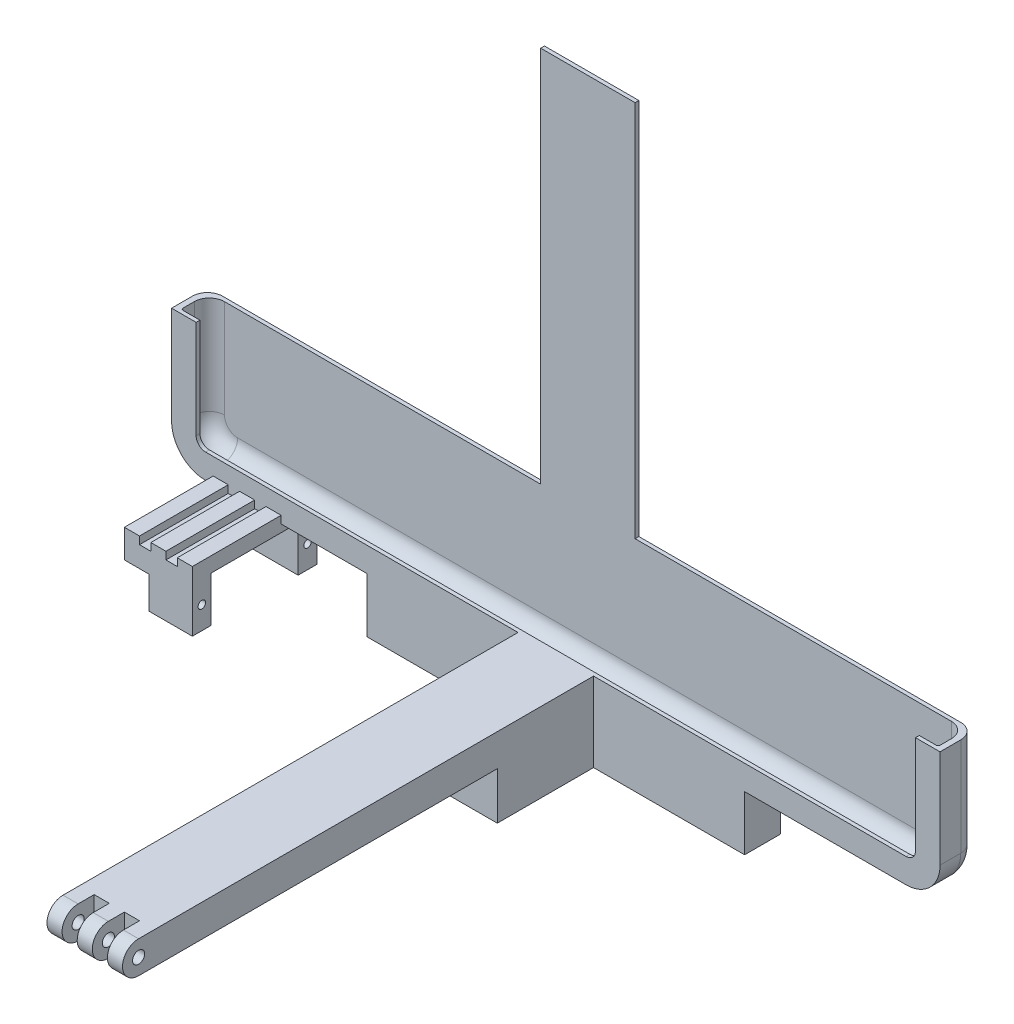
from build123d import *

# Parameters (mm, degrees)
ESQUISSE1_W                    = 203.5
ESQUISSE1_H                    = 35
BOSS_EXTRU_1_DEPTH             = 1
CONG_1_R                       = 9
BOSS_EXTRU_2_START             = 8.5
BOSS_EXTRU_2_DEPTH             = 8.5
BOSS_EXTRU_3_DEPTH             = 1
CONG_2_R                       = 4
CONG_3_R                       = 0.5
BOSS_EXTRU_4_START             = 91.75
BOSS_EXTRU_4_DEPTH             = 20
ESQUISSE8_W                    = 20
ESQUISSE8_H                    = 120.5
BOSS_EXTRU_5_DEPTH             = 6.5
ESQUISSE9_R                    = 4.25
BOSS_EXTRU_6_DEPTH             = 20
BOSS_EXTRU_10_START            = 51.75
BOSS_EXTRU_10_DEPTH            = 100
BOSS_EXTRU_10_START_2          = 91.75
BOSS_EXTRU_10_2_OUTLINE_W      = 12.5
BOSS_EXTRU_10_2_OUTLINE_H      = 25.5
BOSS_EXTRU_10_2_DEPTH          = 20
ESQUISSE21_W                   = 25
ESQUISSE21_H                   = 1
BOSS_EXTRU_11_DEPTH            = 100
ENL_V_MAT_EXTRU_2_DEPTH        = 4
R_P_TITION_LIN_AIRE2_COUNT     = 2
R_P_TITION_LIN_AIRE2_PITCH     = 8
ENL_V_START                    = -20
ESQUISSE12_R                   = 1.6
ENL_V_MAT_EXTRU_4_DEPTH        = 20
BOSS_EXTRU_7_START             = 11
BOSS_EXTRU_7_DEPTH             = 18
ESQUISSE15_W                   = 18
ESQUISSE15_H                   = 5
BOSS_EXTRU_8_DEPTH             = 12
ENL_V_MAT_EXTRU_5_REACH        = 260.26
ESQUISSE16_R                   = 1
ESQUISSE17_W                   = 4
ESQUISSE17_H                   = 23.5
BOSS_EXTRU_9_DEPTH             = 2
R_P_TITION_LIN_AIRE1_COUNT     = 2
R_P_TITION_LIN_AIRE1_PITCH     = 7
R_P_TITION_LIN_AIRE1_COL_COUNT = 2
R_P_TITION_LIN_AIRE1_COL_PITCH = 7
ENL_V_MAT_EXTRU_6_REACH        = 266.365
ESQUISSE18_W                   = 6.5
ESQUISSE18_H                   = 8.5


# Read off the part's stored shape, not the designer's step: Boss.-Extru.4, Boss.-Extru.10, Boss.-Extru.7
with BuildPart() as part:
    # Esquisse1 → Boss.-Extru.1 (new body)
    with BuildSketch(Plane.XY):
        with Locations((101.75, 17.5)):
            Rectangle(ESQUISSE1_W, ESQUISSE1_H)
    extrude(amount=BOSS_EXTRU_1_DEPTH)

    # Congé1
    cong_1_edges = [part.edges().sort_by_distance(p)[0] for p in [
        (203.5, 0, 0.5),
        (0, 0, 0.5),
    ]]
    fillet(cong_1_edges, radius=CONG_1_R)

    # Esquisse3 → Boss.-Extru.2 (add)
    with BuildSketch(Plane.XY.offset(1).offset(BOSS_EXTRU_2_START)):
        with BuildLine():
            Line((1.5, 33.5), (1.5, 35))
            Line((1.5, 35), (0, 35))
            Line((0, 35), (0, 9))
            ThreePointArc((0, 9), (2.636038969, 2.636038969), (9, 0))
            Line((9, 0), (194.5, 0))
            ThreePointArc((194.5, 0), (200.863961031, 2.636038969), (203.5, 9))
            Line((203.5, 9), (203.5, 35))
            Line((203.5, 35), (202, 35))
            Line((202, 35), (202, 33.5))
            Line((202, 33.5), (202, 9))
            ThreePointArc((202, 9), (199.803300859, 3.696699141), (194.5, 1.5))
            Line((194.5, 1.5), (9, 1.5))
            ThreePointArc((9, 1.5), (3.696699141, 3.696699141), (1.5, 9))
            Line((1.5, 9), (1.5, 33.5))
        make_face()
    extrude(amount=-BOSS_EXTRU_2_DEPTH)

    # Esquisse4 → Boss.-Extru.3 (add)
    with BuildSketch(Plane.XY.offset(9.5)):
        with BuildLine():
            Line((6.5, 35), (6.5, 9))
            ThreePointArc((6.5, 9), (7.232233047, 7.232233047), (9, 6.5))
            Line((9, 6.5), (194.5, 6.5))
            ThreePointArc((194.5, 6.5), (196.267766953, 7.232233047), (197, 9))
            Line((197, 9), (197, 35))
            Line((197, 35), (203.5, 35))
            Line((203.5, 35), (203.5, 9))
            ThreePointArc((203.5, 9), (200.863961031, 2.636038969), (194.5, 0))
            Line((194.5, 0), (9, 0))
            ThreePointArc((9, 0), (2.636038969, 2.636038969), (0, 9))
            Line((0, 9), (0, 35))
            Line((0, 35), (6.5, 35))
        make_face()
    extrude(amount=-BOSS_EXTRU_3_DEPTH)

    # Congé2
    cong_2_edges = [part.edges().sort_by_distance(p)[0] for p in [
        (203.5, 22, 0),
        (101.75, 0, 0),
        (2.636038969, 2.636038969, 0),
        (200.863961031, 2.636038969, 0),
        (3.696699141, 3.696699141, 1),
        (101.75, 1.5, 1),
        (199.803300859, 3.696699141, 1),
        (202, 22, 1),
        (1.5, 22, 1),
        (0, 22, 0),
    ]]
    fillet(cong_2_edges, radius=CONG_2_R)

    # Congé3
    cong_3_edges = [part.edges().sort_by_distance(p)[0] for p in [
        (101.75, 1.5, 8.5),
        (1.5, 22, 8.5),
        (3.696699141, 3.696699141, 8.5),
        (199.803300859, 3.696699141, 8.5),
        (202, 22, 8.5),
    ]]
    fillet(cong_3_edges, radius=CONG_3_R)

    # Boss.-Extru.4 outline → Boss.-Extru.4 (add)
    with BuildSketch(Plane.YZ.offset(BOSS_EXTRU_4_START)):
        with BuildLine():
            Line((-2, 130), (-2, 0))
            Line((-2, 0), (4, 0))
            ThreePointArc((4, 0), (1.171572875, 1.171572875), (0, 4))
            Line((0, 4), (0, 130))
            Line((0, 130), (-2, 130))
        make_face()
    extrude(amount=BOSS_EXTRU_4_DEPTH)

    # Esquisse8 → Boss.-Extru.5 (add)
    with BuildSketch(Plane(origin=(0, 0, 0), x_dir=(1, 0, 0), z_dir=(0, 1, 0))):
        with Locations((101.75, -69.75)):
            Rectangle(ESQUISSE8_W, ESQUISSE8_H)
    extrude(amount=BOSS_EXTRU_5_DEPTH)

    # Esquisse9 → Boss.-Extru.6 (add)
    with BuildSketch(Plane.ZY.offset(-91.75)):
        with Locations((130, 2.25)):
            Circle(ESQUISSE9_R)
    extrude(amount=-BOSS_EXTRU_6_DEPTH)

    # Boss.-Extru.10 outline → Boss.-Extru.10 (add)
    with BuildSketch(Plane.YZ.offset(BOSS_EXTRU_10_START)):
        with BuildLine():
            Line((0, 4), (0, 9.5))
            Line((0, 9.5), (-14.5, 9.5))
            Line((-14.5, 9.5), (-14.5, 0))
            Line((-14.5, 0), (4, 0))
            ThreePointArc((4, 0), (1.171572875, 1.171572875), (0, 4))
        make_face()
    extrude(amount=BOSS_EXTRU_10_DEPTH)

    # Boss.-Extru.10 2 outline → Boss.-Extru.10 2 (add)
    with BuildSketch(Plane.YZ.offset(BOSS_EXTRU_10_START_2)):
        with Locations((-8.25, 22.25)):
            Rectangle(BOSS_EXTRU_10_2_OUTLINE_W, BOSS_EXTRU_10_2_OUTLINE_H)
    extrude(amount=BOSS_EXTRU_10_2_DEPTH)

    # Esquisse21 → Boss.-Extru.11 (add)
    with BuildSketch(Plane(origin=(0, 35, 0), x_dir=(1, 0, 0), z_dir=(0, 1, 0))):
        with Locations((101.75, -0.5)):
            Rectangle(ESQUISSE21_W, ESQUISSE21_H)
    extrude(amount=BOSS_EXTRU_11_DEPTH)

    # Esquisse10 → Enlèv. mat.-Extru.2 (cut)
    with BuildSketch(Plane(origin=(95.75, 0, 0), x_dir=(0, 0, -1), z_dir=(1, 0, 0))):
        with BuildLine():
            Line((-125.75, 2.25), (-125.75, 6.5))
            Line((-125.75, 6.5), (-130, 6.5))
            ThreePointArc((-130, 6.5), (-133.00520382, -0.75520382), (-125.75, 2.25))
        make_face()
    enl_v_mat_extru_2 = extrude(amount=ENL_V_MAT_EXTRU_2_DEPTH, mode=Mode.SUBTRACT)

    # Répétition linéaire2: Enlèv. mat.-Extru.2 ×2
    with Locations(*[(i * R_P_TITION_LIN_AIRE2_PITCH, 0, 0) for i in range(1, R_P_TITION_LIN_AIRE2_COUNT)]):
        add(enl_v_mat_extru_2, mode=Mode.SUBTRACT)

    # Esquisse12 → Enlèv. mat.-Extru.4 (cut)
    with BuildSketch(Plane.ZY.offset(-91.75).offset(ENL_V_START)):
        with Locations((130, 2.25)):
            Circle(ESQUISSE12_R)
    extrude(amount=ENL_V_MAT_EXTRU_4_DEPTH, mode=Mode.SUBTRACT)

    # Boss.-Extru.7 outline → Boss.-Extru.7 (add)
    with BuildSketch(Plane.YZ.offset(BOSS_EXTRU_7_START)):
        with BuildLine():
            Line((0, 33), (-2, 33))
            Line((-2, 33), (-2, 0))
            Line((-2, 0), (4, 0))
            ThreePointArc((4, 0), (1.171572875, 1.171572875), (0, 4))
            Line((0, 4), (0, 33))
        make_face()
    extrude(amount=BOSS_EXTRU_7_DEPTH)

    # Esquisse15 → Boss.-Extru.8 (add)
    with BuildSketch(Plane.XZ.offset(2)):
        with Locations((20, 2.5)):
            Rectangle(ESQUISSE15_W, ESQUISSE15_H)
        with Locations((20, 30.5)):
            Rectangle(ESQUISSE15_W, ESQUISSE15_H)
    extrude(amount=BOSS_EXTRU_8_DEPTH)

    # Esquisse16 → Enlèv. mat.-Extru.5 (cut, up to next)
    with BuildSketch(Plane(origin=(29, 0, 0), x_dir=(0, 0, -1), z_dir=(1, 0, 0)), mode=Mode.PRIVATE) as enl_v_mat_extru_5_sk1:
        with Locations((-30.5, -8)):
            Circle(ESQUISSE16_R)
    enl_v_mat_extru_5_tool1 = extrude(enl_v_mat_extru_5_sk1.sketch, amount=-ENL_V_MAT_EXTRU_5_REACH, mode=Mode.PRIVATE) & part.part
    # Esquisse16 → Enlèv. mat.-Extru.5 (cut, up to next)
    with BuildSketch(Plane(origin=(29, 0, 0), x_dir=(0, 0, -1), z_dir=(1, 0, 0)), mode=Mode.PRIVATE) as enl_v_mat_extru_5_sk2:
        with Locations((-2.5, -8)):
            Circle(ESQUISSE16_R)
    enl_v_mat_extru_5_tool2 = extrude(enl_v_mat_extru_5_sk2.sketch, amount=-ENL_V_MAT_EXTRU_5_REACH, mode=Mode.PRIVATE) & part.part
    add(enl_v_mat_extru_5_tool1.solids().sort_by_distance((29, -8, 30.5))[0], mode=Mode.SUBTRACT)
    add(enl_v_mat_extru_5_tool2.solids().sort_by_distance((29, -8, 2.5))[0], mode=Mode.SUBTRACT)

    # Esquisse17 → Boss.-Extru.9 (add)
    with BuildSketch(Plane(origin=(0, 0, 0), x_dir=(1, 0, 0), z_dir=(0, 1, 0))):
        with Locations((20, -21.25)):
            Rectangle(ESQUISSE17_W, ESQUISSE17_H)
    boss_extru_9 = extrude(amount=BOSS_EXTRU_9_DEPTH)

    # Répétition linéaire1: Boss.-Extru.9 ×2
    with Locations(*[(i * R_P_TITION_LIN_AIRE1_PITCH, 0, 0) for i in range(1, R_P_TITION_LIN_AIRE1_COUNT)]):
        add(boss_extru_9)

    # Répétition linéaire1 col: Boss.-Extru.9 ×2
    with Locations(*[(-i * R_P_TITION_LIN_AIRE1_COL_PITCH, 0, 0) for i in range(1, R_P_TITION_LIN_AIRE1_COL_COUNT)]):
        add(boss_extru_9)

    # Esquisse18 → Enlèv. mat.-Extru.6 (cut, up to next)
    with BuildSketch(Plane.XY.offset(33), mode=Mode.PRIVATE) as enl_v_mat_extru_6_sk1:
        with Locations((14.25, -9.75)):
            Rectangle(ESQUISSE18_W, ESQUISSE18_H)
    enl_v_mat_extru_6_tool1 = extrude(enl_v_mat_extru_6_sk1.sketch, amount=-ENL_V_MAT_EXTRU_6_REACH, mode=Mode.PRIVATE) & part.part
    add(enl_v_mat_extru_6_tool1.solids().sort_by_distance((14.25, -9.75, 33))[0], mode=Mode.SUBTRACT)


solid = part.part
